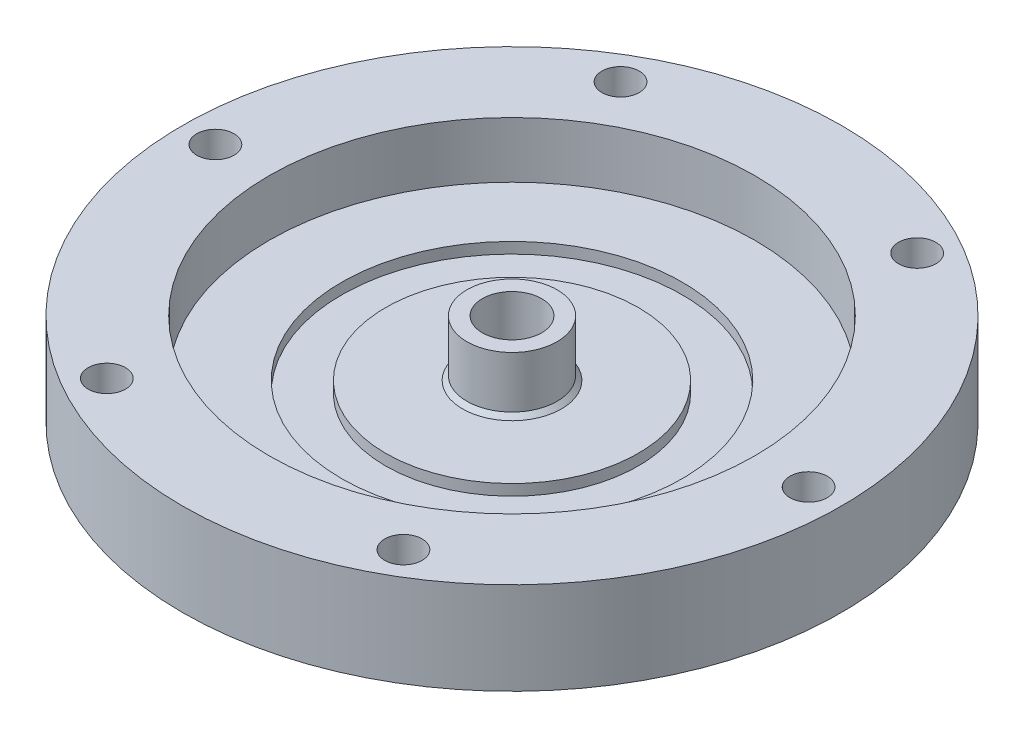
from build123d import *

# Parameters (mm, degrees)
M3_CLEARANCE_HOLE1_OUTLINE_R = 1.7
M3_CLEARANCE_HOLE1_DEPTH     = 8.4
CHAMFER1_SIZE                = 0.4


# Read off the part's stored shape, not the designer's step: M3 Clearance Hole1
with BuildPart() as part:
    # Sketch1 → Revolve1 (revolve)
    with BuildSketch(Plane.XY, mode=Mode.PRIVATE) as revolve1_sk:
        Polygon((2.7, 0), (2.7, 8.4), (4.1, 8.4), (4.1, 3.3), (11.5, 3.3), (11.5, 2.3), (15.5, 2.3), (15.5, 3.3), (22.1, 3.3), (22.1, 8.4), (30, 8.4), (30, 0), align=None)
    revolve(revolve1_sk.sketch.rotate(Axis((0, 16.309231771, 0), (0, -1, 0)), 90), axis=Axis((0, 16.309231771, 0), (0, -1, 0)))

    # M3 Clearance Hole1 outline → M3 Clearance Hole1 (cut)
    with BuildSketch(Plane(origin=(0, 0, 0), x_dir=(1, 0, 0), z_dir=(0, 1, 0))):
        with Locations((13.5, -23.382685902)):
            Circle(M3_CLEARANCE_HOLE1_OUTLINE_R)
        with Locations((-13.5, -23.382685902)):
            Circle(M3_CLEARANCE_HOLE1_OUTLINE_R)
        with Locations((-27, 0)):
            Circle(M3_CLEARANCE_HOLE1_OUTLINE_R)
        with Locations((-13.5, 23.382685902)):
            Circle(M3_CLEARANCE_HOLE1_OUTLINE_R)
        with Locations((13.5, 23.382685902)):
            Circle(M3_CLEARANCE_HOLE1_OUTLINE_R)
        with Locations((27, 0)):
            Circle(M3_CLEARANCE_HOLE1_OUTLINE_R)
    extrude(amount=M3_CLEARANCE_HOLE1_DEPTH, mode=Mode.SUBTRACT)

    # Chamfer1
    chamfer1_edges = [part.edges().sort_by_distance(p)[0] for p in [
        (0, 3.3, -4.1),
    ]]
    chamfer(chamfer1_edges, length=CHAMFER1_SIZE)


solid = part.part
